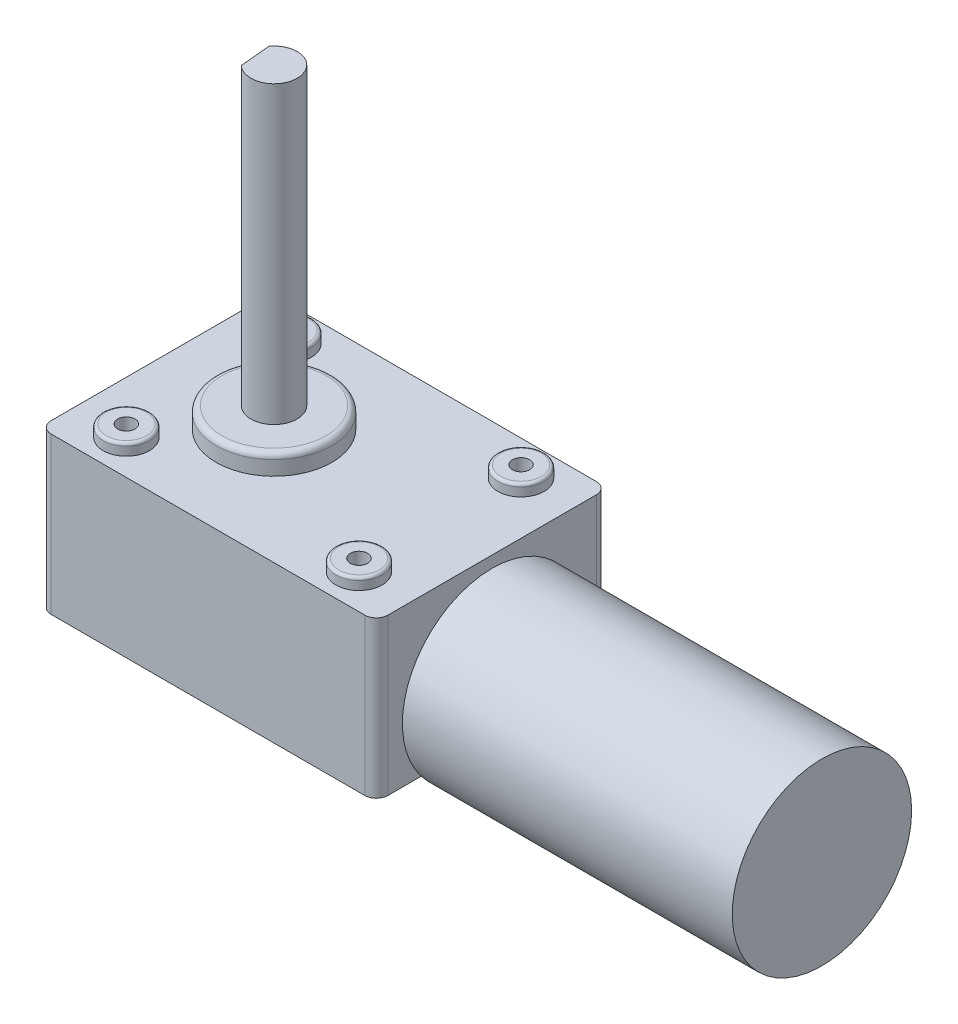
from build123d import *

# Parameters (mm, degrees)
SKETCH1_W           = 58.2
SKETCH1_H           = 40
BOSS_EXTRUDE1_DEPTH = 27
FILLET1_R           = 2
SKETCH2_R           = 15.5
BOSS_EXTRUDE2_DEPTH = 57
SKETCH3_R           = 4
BOSS_EXTRUDE3_DEPTH = 2
SKETCH4_R           = 10
BOSS_EXTRUDE4_DEPTH = 3.5
FILLET2_R           = 0.5
FILLET3_R           = 1
FILLET4_R           = 0.5
FILLET5_R           = 1
BOSS_EXTRUDE5_DEPTH = 51
SKETCH6_R           = 1.5
CUT_EXTRUDE1_DEPTH  = 10


with BuildPart() as part:
    # Sketch1 → Boss-Extrude1 (new body)
    with BuildSketch(Plane(origin=(0, 0, 0), x_dir=(1, 0, 0), z_dir=(0, 1, 0))):
        with Locations((-36.950232558, 6.122325581)):
            Rectangle(SKETCH1_W, SKETCH1_H)
    extrude(amount=BOSS_EXTRUDE1_DEPTH)

    # Fillet1
    fillet1_edges = [part.edges().sort_by_distance(p)[0] for p in [
        (-7.850232558, 13.5, -26.122325581),
        (-66.050232558, 13.5, -26.122325581),
        (-66.050232558, 13.5, 13.877674419),
        (-7.850232558, 13.5, 13.877674419),
    ]]
    fillet(fillet1_edges, radius=FILLET1_R)

    # Sketch2 → Boss-Extrude2 (add)
    with BuildSketch(Plane(origin=(-7.850232558, 0, 0), x_dir=(0, 0, -1), z_dir=(1, 0, 0))):
        with Locations((6.122325581, 9.5)):
            Circle(SKETCH2_R)
    extrude(amount=BOSS_EXTRUDE2_DEPTH)

    # Sketch3 → Boss-Extrude3 (add)
    with BuildSketch(Plane(origin=(0, 27, 0), x_dir=(1, 0, 0), z_dir=(0, 1, 0))):
        with Locations((-16.850232558, -7.877674419)):
            Circle(SKETCH3_R)
        with Locations((-16.850232558, 20.122325581)):
            Circle(SKETCH3_R)
        with Locations((-57.050232558, -7.877674419)):
            Circle(SKETCH3_R)
        with Locations((-57.050232558, 20.122325581)):
            Circle(SKETCH3_R)
    boss_extrude3 = extrude(amount=BOSS_EXTRUDE3_DEPTH)

    # Sketch4 → Boss-Extrude4 (add)
    with BuildSketch(Plane(origin=(0, 27, 0), x_dir=(1, 0, 0), z_dir=(0, 1, 0))):
        with Locations((-45.529984773, 6.122325581)):
            Circle(SKETCH4_R)
    boss_extrude4 = extrude(amount=BOSS_EXTRUDE4_DEPTH)

    # Mirror1: Boss-Extrude3, Boss-Extrude4 across plane
    add(boss_extrude3.mirror(Plane.ZX.offset(13.5)))
    add(boss_extrude4.mirror(Plane.ZX.offset(13.5)))

    # Fillet2
    fillet2_edges = [part.edges().sort_by_distance(p)[0] for p in [
        (-61.050232558, 29, 7.877674419),
        (-61.050232558, 29, -20.122325581),
        (-20.850232558, 29, -20.122325581),
        (-20.850232558, 29, 7.877674419),
    ]]
    fillet(fillet2_edges, radius=FILLET2_R)

    # Fillet3
    fillet3_edges = [part.edges().sort_by_distance(p)[0] for p in [
        (-55.529984773, 30.5, -6.122325581),
    ]]
    fillet(fillet3_edges, radius=FILLET3_R)

    # Mirror6: Boss-Extrude3, Boss-Extrude4 across plane
    add(boss_extrude3.mirror(Plane.ZX.offset(13.5)))
    add(boss_extrude4.mirror(Plane.ZX.offset(13.5)))

    # Fillet4
    fillet4_edges = [part.edges().sort_by_distance(p)[0] for p in [
        (-61.050232558, -2, -20.122325581),
        (-61.050232558, -2, 7.877674419),
        (-20.850232558, -2, 7.877674419),
        (-20.850232558, -2, -20.122325581),
    ]]
    fillet(fillet4_edges, radius=FILLET4_R)

    # Fillet5
    fillet5_edges = [part.edges().sort_by_distance(p)[0] for p in [
        (-55.529984773, -3.5, -6.122325581),
    ]]
    fillet(fillet5_edges, radius=FILLET5_R)

    # Sketch5 → Boss-Extrude5 (add)
    with BuildSketch(Plane(origin=(0, 30.5, 0), x_dir=(1, 0, 0), z_dir=(0, 1, 0))):
        with BuildLine():
            Line((-48.270431405, 3.208573317), (-48.763439554, 8.47705915))
            ThreePointArc((-48.763439554, 8.47705915), (-41.54738383, 6.495004712), (-48.270431405, 3.208573317))
        make_face()
    extrude(amount=BOSS_EXTRUDE5_DEPTH)

    # Sketch6 → Cut-Extrude1 (cut)
    with BuildSketch(Plane(origin=(0, 29, 0), x_dir=(1, 0, 0), z_dir=(0, 1, 0))):
        with Locations((-16.850232558, -7.877674419)):
            Circle(SKETCH6_R)
        with Locations((-16.850232558, 20.122325581)):
            Circle(SKETCH6_R)
        with Locations((-57.050232558, 20.122325581)):
            Circle(SKETCH6_R)
        with Locations((-57.050232558, -7.877674419)):
            Circle(SKETCH6_R)
    extrude(amount=-CUT_EXTRUDE1_DEPTH, mode=Mode.SUBTRACT)


solid = part.part
